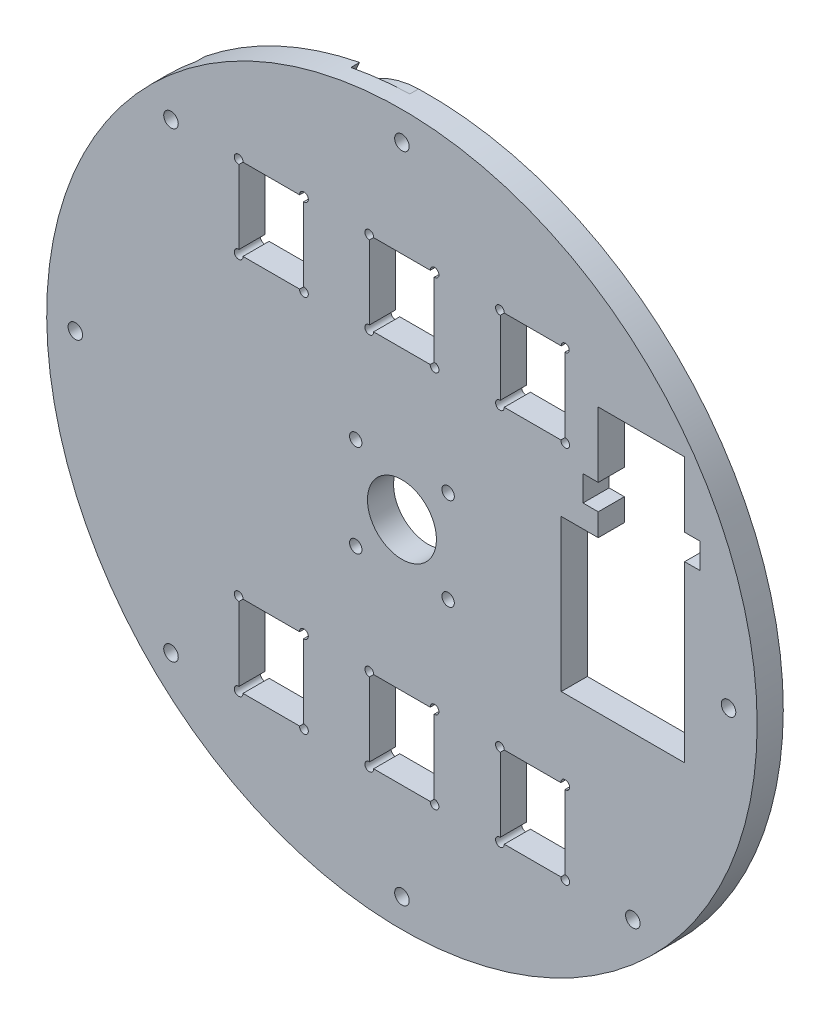
from build123d import *

# Parameters (mm, degrees)
SKETCH1_R              = 81.5
SKETCH1_R_2            = 8
SKETCH1_R_3            = 1.5
SKETCH1_R_4            = 1.75
BOSS_EXTRUDE1_DEPTH    = 6
CUT_EXTRUDE9_DEPTH     = 116.414470497
SKETCH13_W             = 15
SKETCH13_H             = 18.9
CUT_EXTRUDE10_DEPTH    = 116.414470497
SKETCH18_R             = 30
SKETCH18_R_2           = 28.5
CUT_EXTRUDE14_DEPTH    = 2
FILLET2_R              = 20
SKETCH19_R             = 1
CUT_EXTRUDE15_DEPTH    = 116.414470643
MOVE_FACE2_OUTLINE_R   = 8
MOVE_FACE2_OUTLINE_R_2 = 7.92
MOVE_FACE2_OUTLINE_R_3 = 1.5
MOVE_FACE2_OUTLINE_R_4 = 1.42
MOVE_FACE2_OUTLINE_R_5 = 1.75
MOVE_FACE2_OUTLINE_R_6 = 1.67
MOVE_FACE2_DEPTH       = 6
MOVE_START             = 2
MOVE_FACE2_2_DEPTH     = 4


# Read off the part's stored shape, not the designer's step: Move Face2
with BuildPart() as part:
    # Sketch1 → Boss-Extrude1 (new body)
    with BuildSketch(Plane.XY):
        Circle(SKETCH1_R)
        Circle(SKETCH1_R_2, mode=Mode.SUBTRACT)
        with Locations((10.606601718, -10.606601718)):
            Circle(SKETCH1_R_3, mode=Mode.SUBTRACT)
        with Locations((0, -75)):
            Circle(SKETCH1_R_4, mode=Mode.SUBTRACT)
        with Locations((-10.606601718, -10.606601718)):
            Circle(SKETCH1_R_3, mode=Mode.SUBTRACT)
        with Locations((-10.606601718, 10.606601718)):
            Circle(SKETCH1_R_3, mode=Mode.SUBTRACT)
        with Locations((10.606601718, 10.606601718)):
            Circle(SKETCH1_R_3, mode=Mode.SUBTRACT)
        with Locations((-53.033008589, -53.033008589)):
            Circle(SKETCH1_R_4, mode=Mode.SUBTRACT)
        with Locations((-75, 0)):
            Circle(SKETCH1_R_4, mode=Mode.SUBTRACT)
        with Locations((-53.033008589, 53.033008589)):
            Circle(SKETCH1_R_4, mode=Mode.SUBTRACT)
        with Locations((0, 75)):
            Circle(SKETCH1_R_4, mode=Mode.SUBTRACT)
        with Locations((75, 0)):
            Circle(SKETCH1_R_4, mode=Mode.SUBTRACT)
        with Locations((53.033008589, -53.033008589)):
            Circle(SKETCH1_R_4, mode=Mode.SUBTRACT)
    extrude(amount=BOSS_EXTRUDE1_DEPTH)

    # Sketch12 → Cut-Extrude9 (cut, through all)
    with BuildSketch(Plane.XY.offset(6)):
        Polygon((36.5, -16), (65, -16), (65, 24), (68.5, 24), (68.5, 30), (65, 30), (65, 45), (45, 45), (45, 30), (41.5, 30), (41.5, 24), (45, 24), (45, 19), (36.5, 19), align=None)
    extrude(amount=-CUT_EXTRUDE9_DEPTH, mode=Mode.SUBTRACT)

    # Sketch13 → Cut-Extrude10 (cut, through all)
    with BuildSketch(Plane.XY.offset(6)):
        with Locations((-30, -43.45)):
            Rectangle(SKETCH13_W, SKETCH13_H)
        with Locations((-30, 43.45)):
            Rectangle(SKETCH13_W, SKETCH13_H)
        with Locations((30, 43.45)):
            Rectangle(SKETCH13_W, SKETCH13_H)
        with Locations((0, -43.45)):
            Rectangle(SKETCH13_W, SKETCH13_H)
        with Locations((30, -43.45)):
            Rectangle(SKETCH13_W, SKETCH13_H)
        with Locations((0, 43.45)):
            Rectangle(SKETCH13_W, SKETCH13_H)
    extrude(amount=-CUT_EXTRUDE10_DEPTH, mode=Mode.SUBTRACT)

    # Sketch18 → Cut-Extrude14 (cut)
    with BuildSketch(Plane(origin=(0, 0, 0), x_dir=(-1, 0, 0), z_dir=(0, 0, -1))):
        with Locations((42.261826174, 90.630778704)):
            Circle(SKETCH18_R)
        with Locations((42.261826174, 90.630778704)):
            Circle(SKETCH18_R_2, mode=Mode.SUBTRACT)
    extrude(amount=-CUT_EXTRUDE14_DEPTH, mode=Mode.SUBTRACT)

    # Fillet2
    fillet2_edges = [part.edges().sort_by_distance(p)[0] for p in [
        (-52.421789967, 62.403573108, 1),
        (-14.107833342, 80.269664497, 1),
    ]]
    fillet(fillet2_edges, radius=FILLET2_R)

    # Sketch19 → Cut-Extrude15 (cut, through all)
    with BuildSketch(Plane(origin=(0, 0, 0), x_dir=(-1, 0, 0), z_dir=(0, 0, -1))):
        with Locations((-37.5, 52.9)):
            Circle(SKETCH19_R)
        with Locations((-22.5, 52.9)):
            Circle(SKETCH19_R)
        with Locations((-37.5, 34)):
            Circle(SKETCH19_R)
        with Locations((-22.5, 34)):
            Circle(SKETCH19_R)
        with Locations((-7.5, 52.9)):
            Circle(SKETCH19_R)
        with Locations((7.5, 52.9)):
            Circle(SKETCH19_R)
        with Locations((-7.5, 34)):
            Circle(SKETCH19_R)
        with Locations((7.5, 34)):
            Circle(SKETCH19_R)
        with Locations((22.5, 52.9)):
            Circle(SKETCH19_R)
        with Locations((37.5, 52.9)):
            Circle(SKETCH19_R)
        with Locations((22.5, 34)):
            Circle(SKETCH19_R)
        with Locations((37.5, 34)):
            Circle(SKETCH19_R)
        with Locations((-37.5, -34)):
            Circle(SKETCH19_R)
        with Locations((-22.5, -34)):
            Circle(SKETCH19_R)
        with Locations((-37.5, -52.9)):
            Circle(SKETCH19_R)
        with Locations((-22.5, -52.9)):
            Circle(SKETCH19_R)
        with Locations((-7.5, -34)):
            Circle(SKETCH19_R)
        with Locations((7.5, -34)):
            Circle(SKETCH19_R)
        with Locations((-7.5, -52.9)):
            Circle(SKETCH19_R)
        with Locations((7.5, -52.9)):
            Circle(SKETCH19_R)
        with Locations((22.5, -34)):
            Circle(SKETCH19_R)
        with Locations((37.5, -34)):
            Circle(SKETCH19_R)
        with Locations((22.5, -52.9)):
            Circle(SKETCH19_R)
        with Locations((37.5, -52.9)):
            Circle(SKETCH19_R)
    extrude(amount=-CUT_EXTRUDE15_DEPTH, mode=Mode.SUBTRACT)

    # Move Face2 outline → Move Face2 (add)
    # profile 1 of 38: a face of its own
    with BuildSketch(Plane.XY):
        with BuildLine():
            ThreePointArc((-61.073211328, 54.086590372), (34.477197793, -73.936589266), (-2.175628477, 81.550984303))
            ThreePointArc((-2.175628477, 81.550984303), (-11.045848253, 79.219003094), (-17.953798386, 73.18583144))
            ThreePointArc((-17.953798386, 73.18583144), (-29.617087783, 63.514049716), (-44.52312034, 60.79635314))
            ThreePointArc((-44.52312034, 60.79635314), (-53.585142714, 59.382604315), (-61.073211328, 54.086590372))
        make_face()
        with BuildLine():
            ThreePointArc((-61.013320951, 54.033551304), (-53.55508528, 59.308465589), (-44.529166581, 60.716581949))
            ThreePointArc((-44.529166581, 60.716581949), (-29.583278322, 63.441545093), (-17.888803659, 73.139187196))
            ThreePointArc((-17.888803659, 73.139187196), (-11.00837524, 79.14832231), (-2.173494985, 81.471012756))
            ThreePointArc((-2.173494985, 81.471012756), (34.443388332, -73.864084644), (-61.013320951, 54.033551304))
        make_face(mode=Mode.SUBTRACT)
    # profile 2 of 38: a face of its own
    with BuildSketch(Plane.XY):
        with BuildLine():
            ThreePointArc((-15.711454974, 80.052773735), (-34.477197793, 73.936589267), (-51.224853888, 63.492603854))
            ThreePointArc((-51.224853888, 63.492603854), (-30.183396253, 64.72850215), (-15.711454974, 80.052773735))
        make_face()
        with BuildLine():
            ThreePointArc((-51.059856357, 63.522760242), (-34.443388332, 73.864084643), (-15.840614477, 79.945762446))
            ThreePointArc((-15.840614477, 79.945762446), (-30.217205714, 64.801006773), (-51.059856357, 63.522760242))
        make_face(mode=Mode.SUBTRACT)
    # profile 3 of 38: a face of its own
    with BuildSketch(Plane.XY):
        with BuildLine():
            Line((-37.42, -51.903205136), (-37.42, -34.996794864))
            ThreePointArc((-37.42, -34.996794864), (-37.45996791, -34.999198395), (-37.5, -35))
            Line((-37.5, -35), (-37.5, -51.9))
            ThreePointArc((-37.5, -51.9), (-37.45996791, -51.900801605), (-37.42, -51.903205136))
        make_face()
    # profile 4 of 38: a face of its own
    with BuildSketch(Plane.XY):
        with BuildLine():
            Line((-23.5, -34), (-36.5, -34))
            ThreePointArc((-36.5, -34), (-36.500801605, -34.04003209), (-36.503205136, -34.08))
            Line((-36.503205136, -34.08), (-23.496794864, -34.08))
            ThreePointArc((-23.496794864, -34.08), (-23.499198395, -34.04003209), (-23.5, -34))
        make_face()
    # profile 5 of 38: a face of its own
    with BuildSketch(Plane.XY):
        with BuildLine():
            ThreePointArc((-36.503205136, -52.82), (-36.500801605, -52.85996791), (-36.5, -52.9))
            Line((-36.5, -52.9), (-23.5, -52.9))
            ThreePointArc((-23.5, -52.9), (-23.499198395, -52.85996791), (-23.496794864, -52.82))
            Line((-23.496794864, -52.82), (-36.503205136, -52.82))
        make_face()
    # profile 6 of 38: a face of its own
    with BuildSketch(Plane.XY):
        with BuildLine():
            Line((-22.5, -51.9), (-22.5, -35))
            ThreePointArc((-22.5, -35), (-22.54003209, -34.999198395), (-22.58, -34.996794864))
            Line((-22.58, -34.996794864), (-22.58, -51.903205136))
            ThreePointArc((-22.58, -51.903205136), (-22.54003209, -51.900801605), (-22.5, -51.9))
        make_face()
    # profile 7 of 38: a face of its own
    with BuildSketch(Plane.XY):
        with BuildLine():
            Line((-37.42, 34.996794864), (-37.42, 51.903205136))
            ThreePointArc((-37.42, 51.903205136), (-37.45996791, 51.900801605), (-37.5, 51.9))
            Line((-37.5, 51.9), (-37.5, 35))
            ThreePointArc((-37.5, 35), (-37.45996791, 34.999198395), (-37.42, 34.996794864))
        make_face()
    # profile 8 of 38: a face of its own
    with BuildSketch(Plane.XY):
        with BuildLine():
            Line((-23.5, 52.9), (-36.5, 52.9))
            ThreePointArc((-36.5, 52.9), (-36.500801605, 52.85996791), (-36.503205136, 52.82))
            Line((-36.503205136, 52.82), (-23.496794864, 52.82))
            ThreePointArc((-23.496794864, 52.82), (-23.499198395, 52.85996791), (-23.5, 52.9))
        make_face()
    # profile 9 of 38: a face of its own
    with BuildSketch(Plane.XY):
        with BuildLine():
            ThreePointArc((-36.503205136, 34.08), (-36.500801605, 34.04003209), (-36.5, 34))
            Line((-36.5, 34), (-23.5, 34))
            ThreePointArc((-23.5, 34), (-23.499198395, 34.04003209), (-23.496794864, 34.08))
            Line((-23.496794864, 34.08), (-36.503205136, 34.08))
        make_face()
    # profile 10 of 38: a face of its own
    with BuildSketch(Plane.XY):
        with BuildLine():
            Line((-22.5, 35), (-22.5, 51.9))
            ThreePointArc((-22.5, 51.9), (-22.54003209, 51.900801605), (-22.58, 51.903205136))
            Line((-22.58, 51.903205136), (-22.58, 34.996794864))
            ThreePointArc((-22.58, 34.996794864), (-22.54003209, 34.999198395), (-22.5, 35))
        make_face()
    # profile 11 of 38: a face of its own
    with BuildSketch(Plane.XY):
        with BuildLine():
            Line((-6.503205136, -34.08), (6.503205136, -34.08))
            ThreePointArc((6.503205136, -34.08), (6.500801605, -34.04003209), (6.5, -34))
            Line((6.5, -34), (-6.5, -34))
            ThreePointArc((-6.5, -34), (-6.500801605, -34.04003209), (-6.503205136, -34.08))
        make_face()
    # profile 12 of 38: a face of its own
    with BuildSketch(Plane.XY):
        with BuildLine():
            Line((7.5, -51.9), (7.5, -35))
            ThreePointArc((7.5, -35), (7.45996791, -34.999198395), (7.42, -34.996794864))
            Line((7.42, -34.996794864), (7.42, -51.903205136))
            ThreePointArc((7.42, -51.903205136), (7.45996791, -51.900801605), (7.5, -51.9))
        make_face()
    # profile 13 of 38: a face of its own
    with BuildSketch(Plane.XY):
        with BuildLine():
            ThreePointArc((-7.42, -34.996794864), (-7.45996791, -34.999198395), (-7.5, -35))
            Line((-7.5, -35), (-7.5, -51.9))
            ThreePointArc((-7.5, -51.9), (-7.45996791, -51.900801605), (-7.42, -51.903205136))
            Line((-7.42, -51.903205136), (-7.42, -34.996794864))
        make_face()
    # profile 14 of 38: a face of its own
    with BuildSketch(Plane.XY):
        with BuildLine():
            Line((-6.5, -52.9), (6.5, -52.9))
            ThreePointArc((6.5, -52.9), (6.500801605, -52.85996791), (6.503205136, -52.82))
            Line((6.503205136, -52.82), (-6.503205136, -52.82))
            ThreePointArc((-6.503205136, -52.82), (-6.500801605, -52.85996791), (-6.5, -52.9))
        make_face()
    # profile 15 of 38: a face of its own
    with BuildSketch(Plane.XY):
        with BuildLine():
            Line((23.496794864, -34.08), (36.503205136, -34.08))
            ThreePointArc((36.503205136, -34.08), (36.500801605, -34.04003209), (36.5, -34))
            Line((36.5, -34), (23.5, -34))
            ThreePointArc((23.5, -34), (23.499198395, -34.04003209), (23.496794864, -34.08))
        make_face()
    # profile 16 of 38: a face of its own
    with BuildSketch(Plane.XY):
        with BuildLine():
            Line((37.5, -51.9), (37.5, -35))
            ThreePointArc((37.5, -35), (37.45996791, -34.999198395), (37.42, -34.996794864))
            Line((37.42, -34.996794864), (37.42, -51.903205136))
            ThreePointArc((37.42, -51.903205136), (37.45996791, -51.900801605), (37.5, -51.9))
        make_face()
    # profile 17 of 38: a face of its own
    with BuildSketch(Plane.XY):
        with BuildLine():
            ThreePointArc((22.58, -34.996794864), (22.54003209, -34.999198395), (22.5, -35))
            Line((22.5, -35), (22.5, -51.9))
            ThreePointArc((22.5, -51.9), (22.54003209, -51.900801605), (22.58, -51.903205136))
            Line((22.58, -51.903205136), (22.58, -34.996794864))
        make_face()
    # profile 18 of 38: a face of its own
    with BuildSketch(Plane.XY):
        with BuildLine():
            Line((23.5, -52.9), (36.5, -52.9))
            ThreePointArc((36.5, -52.9), (36.500801605, -52.85996791), (36.503205136, -52.82))
            Line((36.503205136, -52.82), (23.496794864, -52.82))
            ThreePointArc((23.496794864, -52.82), (23.499198395, -52.85996791), (23.5, -52.9))
        make_face()
    # profile 19 of 38: a face of its own
    with BuildSketch(Plane.XY):
        with BuildLine():
            Line((23.496794864, 52.82), (36.583484861, 52.82))
            ThreePointArc((36.583484861, 52.82), (38.150538239, 53.550538239), (37.42, 51.983484861))
            Line((37.42, 51.983484861), (37.42, 34.996794864))
            ThreePointArc((37.42, 34.996794864), (37.45996791, 34.999198395), (37.5, 35))
            Line((37.5, 35), (37.5, 51.9))
            ThreePointArc((37.5, 51.9), (38.207106781, 53.607106781), (36.5, 52.9))
            Line((36.5, 52.9), (23.5, 52.9))
            ThreePointArc((23.5, 52.9), (23.499198395, 52.85996791), (23.496794864, 52.82))
        make_face()
    # profile 20 of 38: a face of its own
    with BuildSketch(Plane.XY):
        with BuildLine():
            ThreePointArc((22.58, 51.903205136), (22.54003209, 51.900801605), (22.5, 51.9))
            Line((22.5, 51.9), (22.5, 35))
            ThreePointArc((22.5, 35), (22.54003209, 34.999198395), (22.58, 34.996794864))
            Line((22.58, 34.996794864), (22.58, 51.903205136))
        make_face()
    # profile 21 of 38: a face of its own
    with BuildSketch(Plane.XY):
        with BuildLine():
            Line((23.5, 34), (36.5, 34))
            ThreePointArc((36.5, 34), (36.500801605, 34.04003209), (36.503205136, 34.08))
            Line((36.503205136, 34.08), (23.496794864, 34.08))
            ThreePointArc((23.496794864, 34.08), (23.499198395, 34.04003209), (23.5, 34))
        make_face()
    # profile 22 of 38: a face of its own
    with BuildSketch(Plane.XY):
        with BuildLine():
            Line((-6.503205136, 52.82), (6.503205136, 52.82))
            ThreePointArc((6.503205136, 52.82), (6.500801605, 52.85996791), (6.5, 52.9))
            Line((6.5, 52.9), (-6.5, 52.9))
            ThreePointArc((-6.5, 52.9), (-6.500801605, 52.85996791), (-6.503205136, 52.82))
        make_face()
    # profile 23 of 38: a face of its own
    with BuildSketch(Plane.XY):
        with BuildLine():
            Line((7.5, 35), (7.5, 51.9))
            ThreePointArc((7.5, 51.9), (7.45996791, 51.900801605), (7.42, 51.903205136))
            Line((7.42, 51.903205136), (7.42, 34.996794864))
            ThreePointArc((7.42, 34.996794864), (7.45996791, 34.999198395), (7.5, 35))
        make_face()
    # profile 24 of 38: a face of its own
    with BuildSketch(Plane.XY):
        with BuildLine():
            ThreePointArc((-7.42, 51.903205136), (-7.45996791, 51.900801605), (-7.5, 51.9))
            Line((-7.5, 51.9), (-7.5, 35))
            ThreePointArc((-7.5, 35), (-7.45996791, 34.999198395), (-7.42, 34.996794864))
            Line((-7.42, 34.996794864), (-7.42, 51.903205136))
        make_face()
    # profile 25 of 38: a face of its own
    with BuildSketch(Plane.XY):
        with BuildLine():
            Line((-6.5, 34), (6.5, 34))
            ThreePointArc((6.5, 34), (6.500801605, 34.04003209), (6.503205136, 34.08))
            Line((6.503205136, 34.08), (-6.503205136, 34.08))
            ThreePointArc((-6.503205136, 34.08), (-6.500801605, 34.04003209), (-6.5, 34))
        make_face()
    # profile 26 of 38: a face of its own
    with BuildSketch(Plane.XY):
        Circle(MOVE_FACE2_OUTLINE_R)
        Circle(MOVE_FACE2_OUTLINE_R_2, mode=Mode.SUBTRACT)
    # profile 27 of 38: a face of its own
    with BuildSketch(Plane.XY):
        with Locations((10.606601718, -10.606601718)):
            Circle(MOVE_FACE2_OUTLINE_R_3)
        with Locations((10.606601718, -10.606601718)):
            Circle(MOVE_FACE2_OUTLINE_R_4, mode=Mode.SUBTRACT)
    # profile 28 of 38: a face of its own
    with BuildSketch(Plane.XY):
        with Locations((0, -75)):
            Circle(MOVE_FACE2_OUTLINE_R_5)
        with Locations((0, -75)):
            Circle(MOVE_FACE2_OUTLINE_R_6, mode=Mode.SUBTRACT)
    # profile 29 of 38: a face of its own
    with BuildSketch(Plane.XY):
        with Locations((-10.606601718, -10.606601718)):
            Circle(MOVE_FACE2_OUTLINE_R_3)
        with Locations((-10.606601718, -10.606601718)):
            Circle(MOVE_FACE2_OUTLINE_R_4, mode=Mode.SUBTRACT)
    # profile 30 of 38: a face of its own
    with BuildSketch(Plane.XY):
        with Locations((-10.606601718, 10.606601718)):
            Circle(MOVE_FACE2_OUTLINE_R_3)
        with Locations((-10.606601718, 10.606601718)):
            Circle(MOVE_FACE2_OUTLINE_R_4, mode=Mode.SUBTRACT)
    # profile 31 of 38: a face of its own
    with BuildSketch(Plane.XY):
        with Locations((10.606601718, 10.606601718)):
            Circle(MOVE_FACE2_OUTLINE_R_3)
        with Locations((10.606601718, 10.606601718)):
            Circle(MOVE_FACE2_OUTLINE_R_4, mode=Mode.SUBTRACT)
    # profile 32 of 38: a face of its own
    with BuildSketch(Plane.XY):
        with Locations((-53.033008589, -53.033008589)):
            Circle(MOVE_FACE2_OUTLINE_R_5)
        with Locations((-53.033008589, -53.033008589)):
            Circle(MOVE_FACE2_OUTLINE_R_6, mode=Mode.SUBTRACT)
    # profile 33 of 38: a face of its own
    with BuildSketch(Plane.XY):
        with Locations((-75, 0)):
            Circle(MOVE_FACE2_OUTLINE_R_5)
        with Locations((-75, 0)):
            Circle(MOVE_FACE2_OUTLINE_R_6, mode=Mode.SUBTRACT)
    # profile 34 of 38: a face of its own
    with BuildSketch(Plane.XY):
        with Locations((-53.033008589, 53.033008589)):
            Circle(MOVE_FACE2_OUTLINE_R_5)
        with Locations((-53.033008589, 53.033008589)):
            Circle(MOVE_FACE2_OUTLINE_R_6, mode=Mode.SUBTRACT)
    # profile 35 of 38: a face of its own
    with BuildSketch(Plane.XY):
        with Locations((0, 75)):
            Circle(MOVE_FACE2_OUTLINE_R_5)
        with Locations((0, 75)):
            Circle(MOVE_FACE2_OUTLINE_R_6, mode=Mode.SUBTRACT)
    # profile 36 of 38: a face of its own
    with BuildSketch(Plane.XY):
        with Locations((75, 0)):
            Circle(MOVE_FACE2_OUTLINE_R_5)
        with Locations((75, 0)):
            Circle(MOVE_FACE2_OUTLINE_R_6, mode=Mode.SUBTRACT)
    # profile 37 of 38: a face of its own
    with BuildSketch(Plane.XY):
        with Locations((53.033008589, -53.033008589)):
            Circle(MOVE_FACE2_OUTLINE_R_5)
        with Locations((53.033008589, -53.033008589)):
            Circle(MOVE_FACE2_OUTLINE_R_6, mode=Mode.SUBTRACT)
    # profile 38 of 38: a face of its own
    with BuildSketch(Plane.XY):
        Polygon((45, 19), (36.5, 19), (36.5, -16), (65, -16), (65, 24), (68.5, 24), (68.5, 30), (65, 30), (65, 45), (45, 45), (45, 30), (41.5, 30), (41.5, 24), (45, 24), align=None)
        Polygon((36.58, -15.92), (36.58, 18.92), (45.08, 18.92), (45.08, 24.08), (41.58, 24.08), (41.58, 29.92), (45.08, 29.92), (45.08, 44.92), (64.92, 44.92), (64.92, 29.92), (68.42, 29.92), (68.42, 24.08), (64.92, 24.08), (64.92, -15.92), align=None, mode=Mode.SUBTRACT)
    extrude(amount=MOVE_FACE2_DEPTH)

    # Move Face2 2 outline → Move Face2 2 (add)
    with BuildSketch(Plane.XY.offset(MOVE_START)):
        with BuildLine():
            ThreePointArc((-4.233244047, 81.389984917), (-3.206506152, 81.496938359), (-2.175628477, 81.550984303))
            ThreePointArc((-2.175628477, 81.550984303), (-8.974859181, 81.084821654), (-15.711454974, 80.052773735))
            ThreePointArc((-15.711454974, 80.052773735), (-15.7291327, 80.008510725), (-15.746884219, 79.964277258))
            ThreePointArc((-15.746884219, 79.964277258), (-10.01546514, 80.882262938), (-4.233244047, 81.389984917))
        make_face()
        with BuildLine():
            ThreePointArc((-51.224853888, 63.492603854), (-56.345648769, 58.995459696), (-61.073211328, 54.086590372))
            ThreePointArc((-61.073211328, 54.086590372), (-60.369174336, 54.841548424), (-59.627268849, 55.559326936))
            ThreePointArc((-59.627268849, 55.559326936), (-55.521591174, 59.662407876), (-51.134288174, 63.462859791))
            ThreePointArc((-51.134288174, 63.462859791), (-51.179583432, 63.477694064), (-51.224853888, 63.492603854))
        make_face()
    extrude(amount=MOVE_FACE2_2_DEPTH)


solid = part.part
